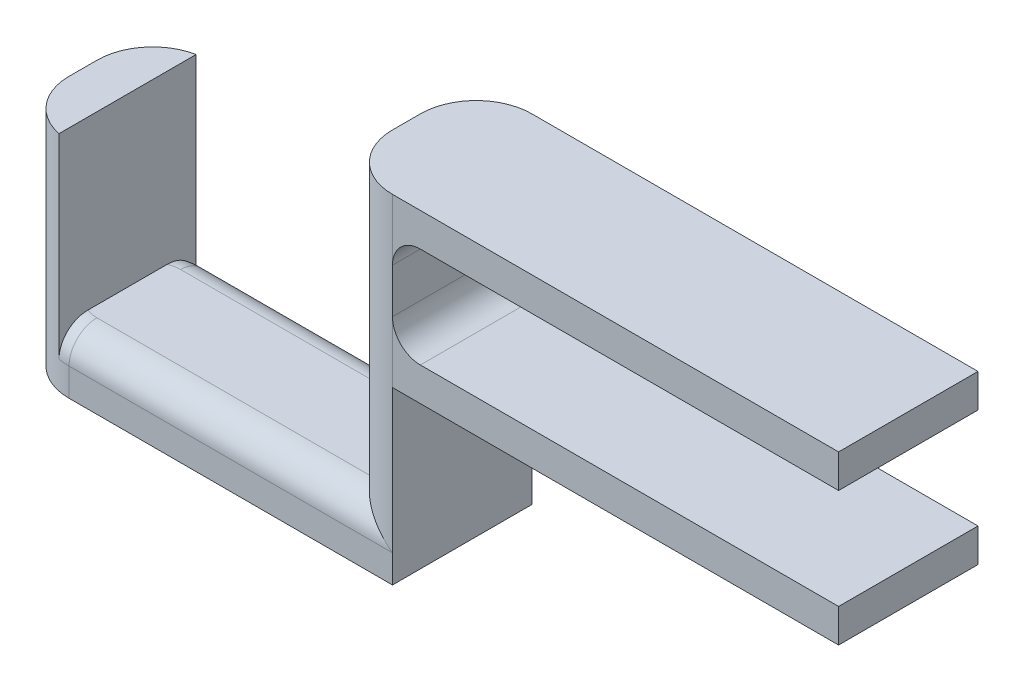
from build123d import *

# Parameters (mm, degrees)
EXTRUDE_1_DEPTH = 25
FILLET_2_R      = 10
FILLET_3_R      = 10
FILLET_4_R      = 10
FILLET_6_R      = 5


with BuildPart() as part:
    # 草圖1 → 填料-伸長1 (new body)
    with BuildSketch(Plane.XY):
        with BuildLine():
            Line((-55.29380505, 11.975806452), (-55.29380505, -28.024193548))
            Line((-55.29380505, -28.024193548), (12.70619495, -28.024193548))
            Line((12.70619495, -28.024193548), (12.70619495, 2.647849462))
            Line((12.70619495, 2.647849462), (92.70619495, 2.647849462))
            Line((92.70619495, 2.647849462), (92.70619495, 8.647849462))
            Line((92.70619495, 8.647849462), (17.70619495, 8.647849462))
            ThreePointArc((17.70619495, 8.647849462), (14.170661044, 10.112315556), (12.70619495, 13.647849462))
            Line((12.70619495, 13.647849462), (12.70619495, 21.647849462))
            ThreePointArc((12.70619495, 21.647849462), (14.170661044, 25.183383368), (17.70619495, 26.647849462))
            Line((17.70619495, 26.647849462), (92.70619495, 26.647849462))
            Line((92.70619495, 26.647849462), (92.70619495, 32.647849462))
            Line((92.70619495, 32.647849462), (2.70619495, 32.647849462))
            Line((2.70619495, 32.647849462), (2.70619495, -18.024193548))
            Line((2.70619495, -18.024193548), (-47.29380505, -18.024193548))
            Line((-47.29380505, -18.024193548), (-47.29380505, 11.975806452))
            Line((-47.29380505, 11.975806452), (-55.29380505, 11.975806452))
        make_face()
    extrude(amount=EXTRUDE_1_DEPTH)

    # 圓角2
    fillet_2_edges = [part.edges().sort_by_distance(p)[0] for p in [
        (-55.29380505, -8.024193548, 0),
    ]]
    fillet(fillet_2_edges, radius=FILLET_2_R)

    # 圓角3
    fillet_3_edges = [part.edges().sort_by_distance(p)[0] for p in [
        (-55.29380505, -8.024193548, 25),
    ]]
    fillet(fillet_3_edges, radius=FILLET_3_R)

    # 圓角4
    fillet_4_edges = [part.edges().sort_by_distance(p)[0] for p in [
        (2.70619495, 7.311827957, 0),
        (2.70619495, 7.311827957, 25),
    ]]
    fillet(fillet_4_edges, radius=FILLET_4_R - 0.0001)  # a hair under: the kernel refuses the full size

    # 圓角6
    fillet_6_edges = [part.edges().sort_by_distance(p)[0] for p in [
        (-16.29385505, -18.024193548, 0),
        (-16.29385505, -18.024193548, 25),
        (-46.29889467, -18.024193548, 0.05063847),
        (-46.29889467, -18.024193548, 24.94936153),
    ]]
    fillet(fillet_6_edges, radius=FILLET_6_R)


solid = part.part
